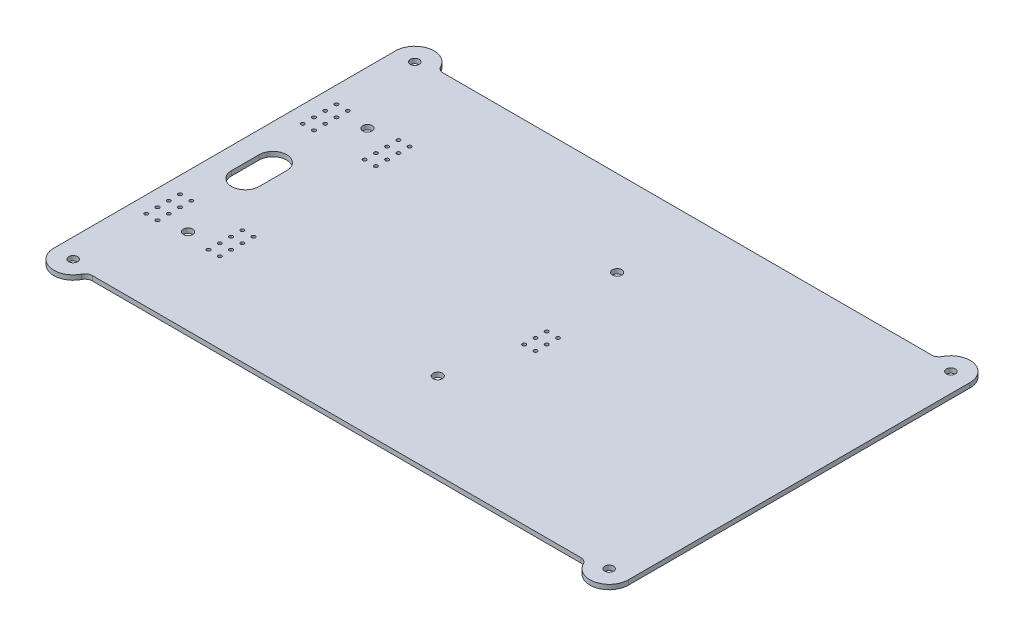
from build123d import *

# Parameters (mm, degrees)
BOSS_EXTRUDE1_DEPTH = 1.5875
SKETCH2_R           = 1.5875
CUT_EXTRUDE1_DEPTH  = 151.292675297
CUT_EXTRUDE2_DEPTH  = 151.292675297
SKETCH7_R           = 0.6
CUT_EXTRUDE3_DEPTH  = 151.292675297
SKETCH9_R           = 1.5
CUT_EXTRUDE4_DEPTH  = 151.292675297


with BuildPart() as part:
    # Sketch1 → Boss-Extrude1 (new body)
    with BuildSketch(Plane(origin=(0, 0, 0), x_dir=(1, 0, 0), z_dir=(0, 1, 0))):
        with BuildLine():
            Line((-58.612, -57.8231), (-58.612, 57.8231))
            ThreePointArc((-58.612, 57.8231), (-53.622056891, 64.146178022), (-46.3122538, 60.762743868))
            ThreePointArc((-46.3122538, 60.762743868), (-45.376104242, 59.746909711), (-44.046749837, 59.371261083))
            Line((-44.046749837, 59.371261083), (121.257272003, 59.371261083))
            ThreePointArc((121.257272003, 59.371261083), (122.586626409, 59.746909711), (123.522775966, 60.762743868))
            ThreePointArc((123.522775966, 60.762743868), (130.832579057, 64.146178022), (135.822522167, 57.8231))
            Line((135.822522167, 57.8231), (135.822522167, -57.8231))
            ThreePointArc((135.822522167, -57.8231), (130.832579057, -64.146178022), (123.522775966, -60.762743868))
            ThreePointArc((123.522775966, -60.762743868), (122.586626409, -59.746909711), (121.257272003, -59.371261083))
            Line((121.257272003, -59.371261083), (-44.046749837, -59.371261083))
            ThreePointArc((-44.046749837, -59.371261083), (-45.376104242, -59.746909711), (-46.3122538, -60.762743868))
            ThreePointArc((-46.3122538, -60.762743868), (-53.622056891, -64.146178022), (-58.612, -57.8231))
        make_face()
    extrude(amount=-BOSS_EXTRUDE1_DEPTH)

    # Sketch2 → Cut-Extrude1 (cut, through all)
    with BuildSketch(Plane(origin=(0, 0, 0), x_dir=(1, 0, 0), z_dir=(0, 1, 0))):
        with Locations((-40.6725, -30.35)):
            Circle(SKETCH2_R)
        with Locations((-40.6725, 30.35)):
            Circle(SKETCH2_R)
        with Locations((43.8275, 30.35)):
            Circle(SKETCH2_R)
        with Locations((43.8275, -30.35)):
            Circle(SKETCH2_R)
    extrude(amount=-CUT_EXTRUDE1_DEPTH, mode=Mode.SUBTRACT)

    # Sketch3 → Cut-Extrude2 (cut, through all)
    with BuildSketch(Plane(origin=(0, 0, 0), x_dir=(1, 0, 0), z_dir=(0, 1, 0))):
        with BuildLine():
            Line((-41.933471413, 4.284952831), (-41.933471413, -5.034952831))
            ThreePointArc((-41.933471413, -5.034952831), (-46.603471413, -9.704952831), (-51.273471413, -5.034952831))
            Line((-51.273471413, -5.034952831), (-51.273471413, 4.284952831))
            ThreePointArc((-51.273471413, 4.284952831), (-46.603471413, 8.954952831), (-41.933471413, 4.284952831))
        make_face()
    extrude(amount=-CUT_EXTRUDE2_DEPTH, mode=Mode.SUBTRACT)

    # Sketch7 → Cut-Extrude3 (cut, through all)
    with BuildSketch(Plane.XZ.offset(1.5875)):
        with Locations((49.2175, 6.483)):
            Circle(SKETCH7_R)
        with Locations((-49.1085, -32.125)):
            Circle(SKETCH7_R)
        with Locations((-28.1535, -32.125)):
            Circle(SKETCH7_R)
        with Locations((-28.1535, 20.707)):
            Circle(SKETCH7_R)
        with Locations((-49.2355, 20.707)):
            Circle(SKETCH7_R)
        with Locations((-31.9635, 20.707)):
            Circle(SKETCH7_R)
        with Locations((-53.0455, 20.707)):
            Circle(SKETCH7_R)
        with Locations((-31.9635, 28.327)):
            Circle(SKETCH7_R)
        with Locations((-53.0455, 28.327)):
            Circle(SKETCH7_R)
        with Locations((-31.9635, 24.517)):
            Circle(SKETCH7_R)
        with Locations((-53.0455, 24.517)):
            Circle(SKETCH7_R)
        with Locations((-31.9635, -28.315)):
            Circle(SKETCH7_R)
        with Locations((-52.9185, -28.315)):
            Circle(SKETCH7_R)
        with Locations((-31.9635, -32.125)):
            Circle(SKETCH7_R)
        with Locations((-52.9185, -32.125)):
            Circle(SKETCH7_R)
        with Locations((-28.1535, 24.517)):
            Circle(SKETCH7_R)
        with Locations((-49.2355, 24.517)):
            Circle(SKETCH7_R)
        with Locations((-31.9635, 32.137)):
            Circle(SKETCH7_R)
        with Locations((-53.0455, 32.137)):
            Circle(SKETCH7_R)
        with Locations((-31.9635, -20.695)):
            Circle(SKETCH7_R)
        with Locations((-52.9185, -20.695)):
            Circle(SKETCH7_R)
        with Locations((-31.9635, -24.505)):
            Circle(SKETCH7_R)
        with Locations((-52.9185, -24.505)):
            Circle(SKETCH7_R)
        with Locations((-28.1535, 32.137)):
            Circle(SKETCH7_R)
        with Locations((-49.2355, 32.137)):
            Circle(SKETCH7_R)
        with Locations((-28.1535, 28.327)):
            Circle(SKETCH7_R)
        with Locations((-49.2355, 28.327)):
            Circle(SKETCH7_R)
        with Locations((-28.1535, -24.505)):
            Circle(SKETCH7_R)
        with Locations((-49.1085, -24.505)):
            Circle(SKETCH7_R)
        with Locations((-28.1535, -28.315)):
            Circle(SKETCH7_R)
        with Locations((-49.1085, -28.315)):
            Circle(SKETCH7_R)
        with Locations((49.2175, 2.673)):
            Circle(SKETCH7_R)
        with Locations((53.0275, -1.137)):
            Circle(SKETCH7_R)
        with Locations((53.0275, 2.673)):
            Circle(SKETCH7_R)
        with Locations((53.0275, 6.483)):
            Circle(SKETCH7_R)
        with Locations((-28.1535, -20.695)):
            Circle(SKETCH7_R)
        with Locations((-49.1085, -20.695)):
            Circle(SKETCH7_R)
        with Locations((49.2175, -1.137)):
            Circle(SKETCH7_R)
    extrude(amount=-CUT_EXTRUDE3_DEPTH, mode=Mode.SUBTRACT)

    # Sketch9 → Cut-Extrude4 (cut, through all)
    with BuildSketch(Plane(origin=(0, 0, 0), x_dir=(1, 0, 0), z_dir=(0, 1, 0))):
        with Locations((-52.110838917, 57.8231)):
            Circle(SKETCH9_R)
        with Locations((-52.110838917, -57.8231)):
            Circle(SKETCH9_R)
        with Locations((129.321361083, 57.8231)):
            Circle(SKETCH9_R)
        with Locations((129.321361083, -57.8231)):
            Circle(SKETCH9_R)
    extrude(amount=-CUT_EXTRUDE4_DEPTH, mode=Mode.SUBTRACT)


solid = part.part
